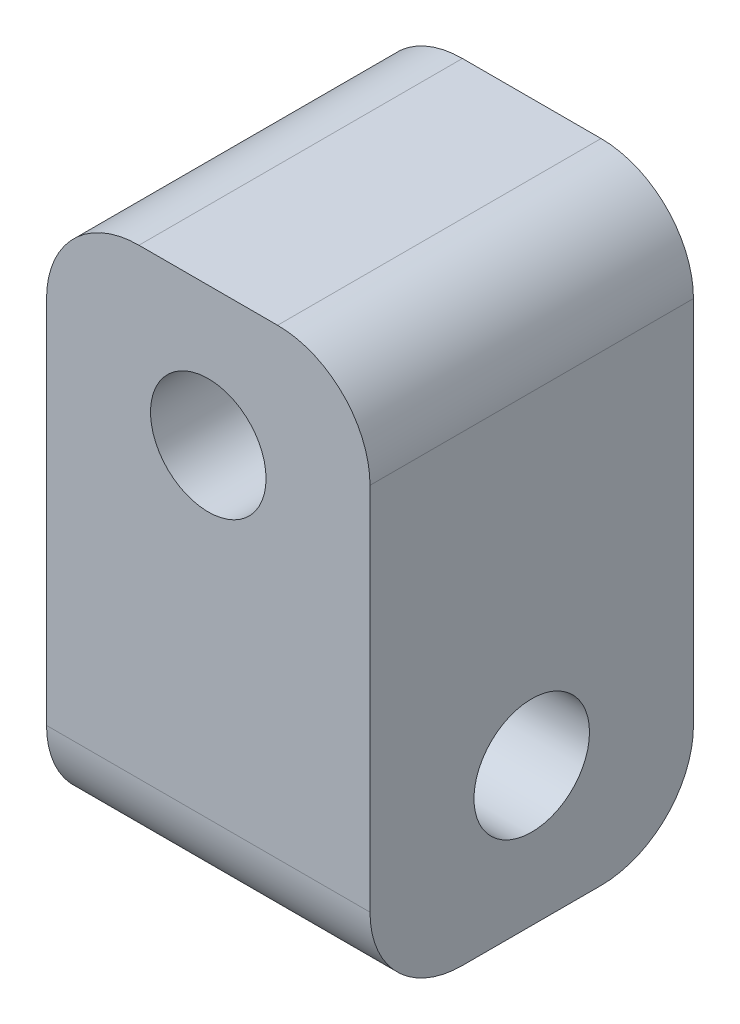
from build123d import *

# Parameters (mm, degrees)
SKETCH1_R           = 12.5
BOSS_EXTRUDE1_DEPTH = 70
SKETCH2_R           = 12.5
BOSS_EXTRUDE2_DEPTH = 35


with BuildPart() as part:
    # Sketch1 → Boss-Extrude1 (new body)
    with BuildSketch(Plane.XY):
        with BuildLine():
            Line((-15, 30.000666872), (15, 30.000666872))
            ThreePointArc((15, 30.000666872), (29.142135624, 24.142802496), (35, 10.000666872))
            Line((35, 10.000666872), (35, -29.999333128))
            Line((35, -29.999333128), (-35, -29.999333128))
            Line((-35, -29.999333128), (-35, 10.000666872))
            ThreePointArc((-35, 10.000666872), (-29.142135624, 24.142802496), (-15, 30.000666872))
        make_face()
        Circle(SKETCH1_R, mode=Mode.SUBTRACT)
    extrude(amount=BOSS_EXTRUDE1_DEPTH)

    # Sketch2 → Boss-Extrude2 (add, symmetric)
    with BuildSketch(Plane(origin=(0, 0, 0), x_dir=(0, 0, -1), z_dir=(1, 0, 0))):
        with BuildLine():
            Line((-70, -29.999333128), (-70, -69.999333128))
            ThreePointArc((-70, -69.999333128), (-64.142135624, -84.141468752), (-50, -89.999333128))
            Line((-50, -89.999333128), (-20, -89.999333128))
            ThreePointArc((-20, -89.999333128), (-5.857864376, -84.141468752), (0, -69.999333128))
            Line((0, -69.999333128), (0, -29.999333128))
            Line((0, -29.999333128), (-70, -29.999333128))
        make_face()
        with Locations((-35, -59.999333128)):
            Circle(SKETCH2_R, mode=Mode.SUBTRACT)
    extrude(amount=BOSS_EXTRUDE2_DEPTH, both=True)


solid = part.part
